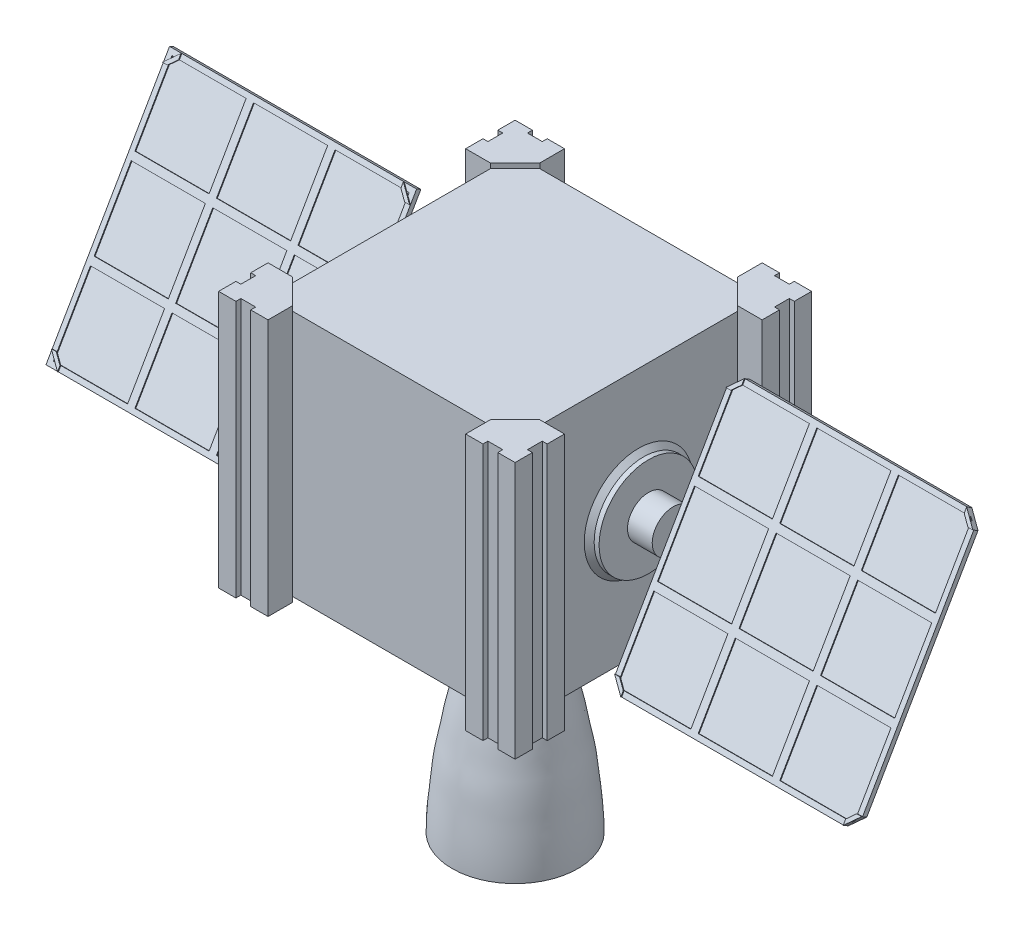
from build123d import *

# Parameters (mm, degrees)
SKETCH1_W           = 12.7
SKETCH1_H           = 12.7
BOSS_EXTRUDE1_DEPTH = 127
BOSS_EXTRUDE2_DEPTH = 2.54
SKETCH3_W           = 7.62
SKETCH3_H           = 2.54
SKETCH3_W_2         = 2.54
SKETCH3_H_2         = 7.62
CUT_EXTRUDE1_DEPTH  = 171.464091233
CIRPATTERN1_COUNT   = 4
SKETCH5_R           = 25.4
BOSS_EXTRUDE3_DEPTH = 5.08
CHAMFER1_SIZE       = 2.54
SKETCH6_R           = 10.795
BOSS_EXTRUDE4_DEPTH = 12.7
BOSS_EXTRUDE5_DEPTH = 1.27
CHAMFER2_SIZE       = 6.35
SKETCH9_W           = 38.1
SKETCH9_H           = 38.1
CUT_EXTRUDE4_DEPTH  = 0.508
BOSS_EXTRUDE6_DEPTH = 0.508
CHAMFER3_SIZE       = 6.35


with BuildPart() as part:
    # Sketch1 → Boss-Extrude1 (new body)
    with BuildSketch(Plane(origin=(0, 0, 0), x_dir=(1, 0, 0), z_dir=(0, 1, 0))):
        Polygon((-50.8, -63.5), (50.8, -63.5), (50.8, -50.8), (63.5, -50.8), (63.5, 50.8), (50.8, 50.8), (50.8, 63.5), (-50.8, 63.5), (-50.8, 50.8), (-63.5, 50.8), (-63.5, -50.8), (-50.8, -50.8), align=None)
        Polygon((-76.2, 50.8), (-63.5, 50.8), (-63.5, 63.5), (-50.8, 63.5), (-50.8, 76.2), (-76.2, 76.2), align=None)
        with Locations((-57.15, 57.15)):
            Rectangle(SKETCH1_W, SKETCH1_H)
        Polygon((63.5, 63.5), (63.5, 50.8), (76.2, 50.8), (76.2, 76.2), (50.8, 76.2), (50.8, 63.5), align=None)
        with Locations((57.15, 57.15)):
            Rectangle(SKETCH1_W, SKETCH1_H)
        Polygon((63.5, -50.8), (63.5, -63.5), (50.8, -63.5), (50.8, -76.2), (76.2, -76.2), (76.2, -50.8), align=None)
        with Locations((57.15, -57.15)):
            Rectangle(SKETCH1_W, SKETCH1_H)
        Polygon((-50.8, -76.2), (-50.8, -63.5), (-63.5, -63.5), (-63.5, -50.8), (-76.2, -50.8), (-76.2, -76.2), align=None)
        with Locations((-57.15, -57.15)):
            Rectangle(SKETCH1_W, SKETCH1_H)
    extrude(amount=BOSS_EXTRUDE1_DEPTH)

    # Sketch2 → Boss-Extrude2 (add)
    with BuildSketch(Plane.XZ):
        Polygon((-63.5, 50.8), (-50.8, 63.5), (-50.8, 76.2), (-76.2, 76.2), (-76.2, 50.8), align=None)
        Polygon((50.8, 63.5), (63.5, 50.8), (76.2, 50.8), (76.2, 76.2), (50.8, 76.2), align=None)
        Polygon((63.5, -50.8), (50.8, -63.5), (50.8, -76.2), (76.2, -76.2), (76.2, -50.8), align=None)
        Polygon((-63.5, -50.8), (-50.8, -63.5), (-50.8, -76.2), (-76.2, -76.2), (-76.2, -50.8), align=None)
    boss_extrude2 = extrude(amount=BOSS_EXTRUDE2_DEPTH)

    # Mirror1: Boss-Extrude2 across plane
    add(boss_extrude2.mirror(Plane.ZX.offset(63.5)))

    # Sketch3 → Cut-Extrude1 (cut, through all)
    with BuildSketch(Plane(origin=(0, 129.54, 0), x_dir=(1, 0, 0), z_dir=(0, 1, 0))):
        with Locations((63.5, 74.93)):
            Rectangle(SKETCH3_W, SKETCH3_H)
        with Locations((74.93, 63.5)):
            Rectangle(SKETCH3_W_2, SKETCH3_H_2)
    cut_extrude1 = extrude(amount=-CUT_EXTRUDE1_DEPTH, mode=Mode.SUBTRACT)

    # CirPattern1: Cut-Extrude1 ×4 about axis
    cirpattern1_axis = Axis((0, 0, 0), (0, 1, 0))
    for i in range(1, CIRPATTERN1_COUNT):
        add(cut_extrude1.rotate(cirpattern1_axis, i * 360 / CIRPATTERN1_COUNT), mode=Mode.SUBTRACT)

    # Sketch5 → Boss-Extrude3 (add)
    with BuildSketch(Plane(origin=(63.5, 0, 0), x_dir=(0, 0, -1), z_dir=(1, 0, 0))):
        with Locations(Location((0, 63.5, 0), (0, 0, 180))):
            Circle(SKETCH5_R)
    boss_extrude3 = extrude(amount=BOSS_EXTRUDE3_DEPTH)

    # Chamfer1
    chamfer1_edges = [part.edges().sort_by_distance(p)[0] for p in [
        (63.5, 63.5, -25.4),
    ]]
    chamfer(chamfer1_edges, length=CHAMFER1_SIZE)

    # Sketch6 → Boss-Extrude4 (add)
    with BuildSketch(Plane(origin=(68.58, 0, 0), x_dir=(0, 0, -1), z_dir=(1, 0, 0))):
        with Locations((0, 63.5)):
            Circle(SKETCH6_R)
    boss_extrude4 = extrude(amount=BOSS_EXTRUDE4_DEPTH)

    # Sketch8 → Boss-Extrude5 (add, symmetric)
    with BuildSketch(Plane(origin=(81.28, 63.5, 0), x_dir=(-1, 0, 0), z_dir=(0, -0.4999999999999962, -0.8660254037844408))):
        Polygon((0, 0), (0, 63.5), (-127, 63.5), (-127, -63.5), (0, -63.5), align=None)
    boss_extrude5 = extrude(amount=BOSS_EXTRUDE5_DEPTH, both=True)

    # Chamfer2
    chamfer2_edges = [part.edges().sort_by_distance(p)[0] for p in [
        (81.28, 118.49261314, -31.75),
        (81.28, 8.50738686, 31.75),
        (208.28, 8.50738686, 31.75),
        (208.28, 118.49261314, -31.75),
    ]]
    chamfer(chamfer2_edges, length=CHAMFER2_SIZE)

    # Sketch9 → Cut-Extrude4 (cut)
    with BuildSketch(Plane(origin=(0, 16.51, 28.596158833), x_dir=(1, 0, 0), z_dir=(0, 0.4999999999999961, 0.8660254037844409))):
        with Locations((144.78, 54.99261314)):
            Rectangle(SKETCH9_W, SKETCH9_H)
        with Locations((186.69, 54.99261314)):
            Rectangle(SKETCH9_W, SKETCH9_H)
        with Locations((102.87, 54.99261314)):
            Rectangle(SKETCH9_W, SKETCH9_H)
        with Locations((144.78, 96.90261314)):
            Rectangle(SKETCH9_W, SKETCH9_H)
        with Locations((186.69, 96.90261314)):
            Rectangle(SKETCH9_W, SKETCH9_H)
        with Locations((102.87, 96.90261314)):
            Rectangle(SKETCH9_W, SKETCH9_H)
        with Locations((144.78, 13.08261314)):
            Rectangle(SKETCH9_W, SKETCH9_H)
        with Locations((186.69, 13.08261314)):
            Rectangle(SKETCH9_W, SKETCH9_H)
        with Locations((102.87, 13.08261314)):
            Rectangle(SKETCH9_W, SKETCH9_H)
    cut_extrude4 = extrude(amount=-CUT_EXTRUDE4_DEPTH, mode=Mode.SUBTRACT)

    # Sketch11 → Boss-Extrude6 (add)
    with BuildSketch(Plane(origin=(0, 16.51, 28.596158833), x_dir=(1, 0, 0), z_dir=(0, 0.4999999999999961, 0.8660254037844409))):
        Polygon((204.47, 115.95261314), (201.93, 118.49261314), (201.93, 115.95261314), align=None)
        Polygon((204.47, 115.95261314), (201.93, 115.95261314), (205.74, 112.14261314), (205.74, 114.68261314), align=None)
        Polygon((205.74, 114.68261314), (205.74, 112.14261314), (208.28, 112.14261314), align=None)
        Polygon((85.09, 115.95261314), (87.63, 115.95261314), (87.63, 118.49261314), align=None)
        Polygon((83.82, 114.68261314), (83.82, 112.14261314), (87.63, 115.95261314), (85.09, 115.95261314), align=None)
        Polygon((83.82, 114.68261314), (81.28, 112.14261314), (83.82, 112.14261314), align=None)
        Polygon((208.28, -2.15738686), (205.74, -2.15738686), (205.74, -4.69738686), align=None)
        Polygon((205.74, -2.15738686), (201.93, -5.96738686), (204.47, -5.96738686), (205.74, -4.69738686), align=None)
        Polygon((201.93, -5.96738686), (201.93, -8.50738686), (204.47, -5.96738686), align=None)
        Polygon((85.09, -5.96738686), (87.63, -8.50738686), (87.63, -5.96738686), align=None)
        Polygon((85.09, -5.96738686), (87.63, -5.96738686), (83.82, -2.15738686), (83.82, -4.69738686), align=None)
        Polygon((83.82, -4.69738686), (83.82, -2.15738686), (81.28, -2.15738686), align=None)
    boss_extrude6 = extrude(amount=BOSS_EXTRUDE6_DEPTH)

    # Mirror4: Boss-Extrude3, Boss-Extrude4, Boss-Extrude5, Cut-Extrude4, Boss-Extrude6 across plane
    add(boss_extrude3.mirror(Plane(origin=(0, 0, 0), x_dir=(0, 0, 1), z_dir=(1, 0, 0))))
    add(boss_extrude4.mirror(Plane(origin=(0, 0, 0), x_dir=(0, 0, 1), z_dir=(1, 0, 0))))
    add(boss_extrude5.mirror(Plane(origin=(0, 0, 0), x_dir=(0, 0, 1), z_dir=(1, 0, 0))))
    add(cut_extrude4.mirror(Plane(origin=(0, 0, 0), x_dir=(0, 0, 1), z_dir=(1, 0, 0))), mode=Mode.SUBTRACT)
    add(boss_extrude6.mirror(Plane(origin=(0, 0, 0), x_dir=(0, 0, 1), z_dir=(1, 0, 0))))

    # Chamfer3
    # the kernel refuses this chamfer: 6.35 mm, written as the material it adds along each edge
    with BuildSketch(Plane(origin=(-63.5, 63.5, 0), x_dir=(0, 0, 1), z_dir=(0, 1, 0))) as chamfer3_piece_1_section:
        Polygon((25.4 + CHAMFER3_SIZE, 0), (25.4, -CHAMFER3_SIZE), (25.4, 0), align=None)
    chamfer3_piece_1 = revolve(axis=Axis((-63.5, 63.5, 0), (1, 0, 0)), mode=Mode.PRIVATE)
    chamfer3_piece_1 = split(chamfer3_piece_1, bisect_by=Plane(origin=(-68.58, 63.5, 0), z_dir=(1, 0, 0)), keep=Keep.TOP, mode=Mode.PRIVATE)
    add(chamfer3_piece_1)

    # Sketch13 → Revolve1 (revolve)
    with BuildSketch(Plane.XY, mode=Mode.PRIVATE) as revolve1_sk:
        with BuildLine():
            Line((-14.833669969, -1.977316059), (-14.833669969, 0))
            Line((-14.833669969, 0), (-8.79937455, 0))
            add(Edge.make_bspline(
                [(-8.79937455, 0), (-8.382377727, -0.569068612), (-8.54839767, -1.773704829), (-8.388947704, -3.530695535), (-8.564710671, -6.079477182), (-8.678787775, -9.521550728), (-9.61847314, -14.131364487), (-10.634383142, -18.609379189), (-11.208573433, -22.525958036), (-12.279523775, -25.721310785), (-12.761547061, -29.31926606), (-14.239157815, -33.691853777), (-15.243547153, -39.061761498), (-17.22980603, -46.728164535), (-19.560579375, -56.221301793), (-21.120276844, -66.567534252), (-23.335805558, -76.311153198), (-24.129437569, -85.531575638), (-25.120416211, -94.143574475), (-25.833386191, -102.470107375), (-26.037158256, -107.970097928), (-26.016962295, -111.228743349)],
                knots=[0, 0, 0, 0, 0.01728593, 0.031097639, 0.046977458, 0.084916179, 0.122447952, 0.17152206, 0.206992779, 0.227203649, 0.260750677, 0.302918791, 0.349339678, 0.405617495, 0.513203878, 0.608650099, 0.683283951, 0.77816808, 0.853919366, 0.913546749, 1, 1, 1, 1], degree=3))
            Line((-26.016962295, -111.228743349), (-32.366840343, -111.268097706))
            add(Edge.make_bspline(
                [(-14.833669969, -1.977316059), (-14.833848243, -2.097012886), (-14.831004367, -2.346846122), (-14.818009094, -2.76285642), (-14.797244492, -3.182521156), (-14.783536361, -3.506685895), (-14.781406491, -3.70858541), (-14.794321444, -4.106843657), (-14.825434123, -4.626525191), (-14.86244473, -5.254533923), (-14.900720777, -5.993240901), (-14.945072159, -6.826672922), (-14.994020062, -7.600759158), (-15.072138036, -8.553417773), (-15.207328541, -9.604631194), (-15.476340421, -11.072086112), (-15.819430904, -12.684116901), (-16.189855588, -14.384664814), (-16.562999933, -16.141031), (-16.866048289, -17.699872116), (-17.076838577, -18.920569956), (-17.262325529, -19.999790109), (-17.446928617, -20.933652182), (-17.622560965, -21.613973991), (-17.843931978, -22.356031028), (-18.085800271, -23.168755769), (-18.29006908, -23.958497942), (-18.546293107, -25.072631705), (-18.746378368, -26.192116148), (-18.938943582, -27.213130912), (-19.110536935, -28.007823913), (-19.423548339, -29.165188517), (-19.919517422, -30.813457945), (-20.459581312, -32.811321852), (-20.87116666, -34.668511682), (-21.230310296, -36.400882552), (-21.680152757, -38.481831468), (-22.343315245, -41.164713347), (-23.2123619, -44.546070508), (-24.063430772, -47.977890711), (-24.876918995, -51.456464719), (-25.631755557, -55.001584738), (-26.286115776, -58.563092826), (-26.872502839, -62.001336704), (-27.454123306, -65.322868954), (-28.108025955, -68.565734045), (-28.831245346, -72.040804669), (-29.483189419, -75.770890311), (-29.942033627, -79.426419358), (-30.304750446, -82.974285628), (-30.638696829, -86.369666146), (-31.135675287, -90.926293327), (-31.752631414, -96.809463519), (-32.261781778, -103.965497123), (-32.381875269, -108.842192409), (-32.366840343, -111.268097706)],
                knots=[0.018087892, 0.018087892, 0.018087892, 0.018087892, 0.020005689, 0.021923486, 0.02575908, 0.029594674, 0.033430268, 0.041101457, 0.044937051, 0.048772645, 0.056443833, 0.064115022, 0.07178621, 0.079457398, 0.094799775, 0.110142152, 0.125484528, 0.140826905, 0.156169282, 0.171511659, 0.179182847, 0.186854035, 0.202196412, 0.2098676, 0.217538789, 0.225209977, 0.229045571, 0.232881165, 0.248223542, 0.25589473, 0.263565919, 0.278908295, 0.294250672, 0.309593049, 0.324935425, 0.340277802, 0.355620179, 0.386304932, 0.416989686, 0.447674439, 0.478359192, 0.509043946, 0.539728699, 0.570413453, 0.601098206, 0.631782959, 0.662467713, 0.693152466, 0.72383722, 0.754521973, 0.785206726, 0.81589148, 0.877260986, 0.938630493, 1, 1, 1, 1], degree=3))
        make_face()
    revolve(revolve1_sk.sketch.rotate(Axis((0, 0, 0), (0, -1, 0)), 270), axis=Axis((0, 0, 0), (0, -1, 0)))

    # Chamfer4: read off the stored shape, not the designer's step
    # Chamfer4 outline → Chamfer4 (revolve)
    with BuildSketch(Plane.XY):
        Polygon((14.939714459, -6.710105821), (21.279495512, 0), (14.833669969, 0), (14.833669969, -6.710105821), align=None)
    revolve(axis=Axis((0, 0, 0), (0, 1, 0)))


solid = part.part
